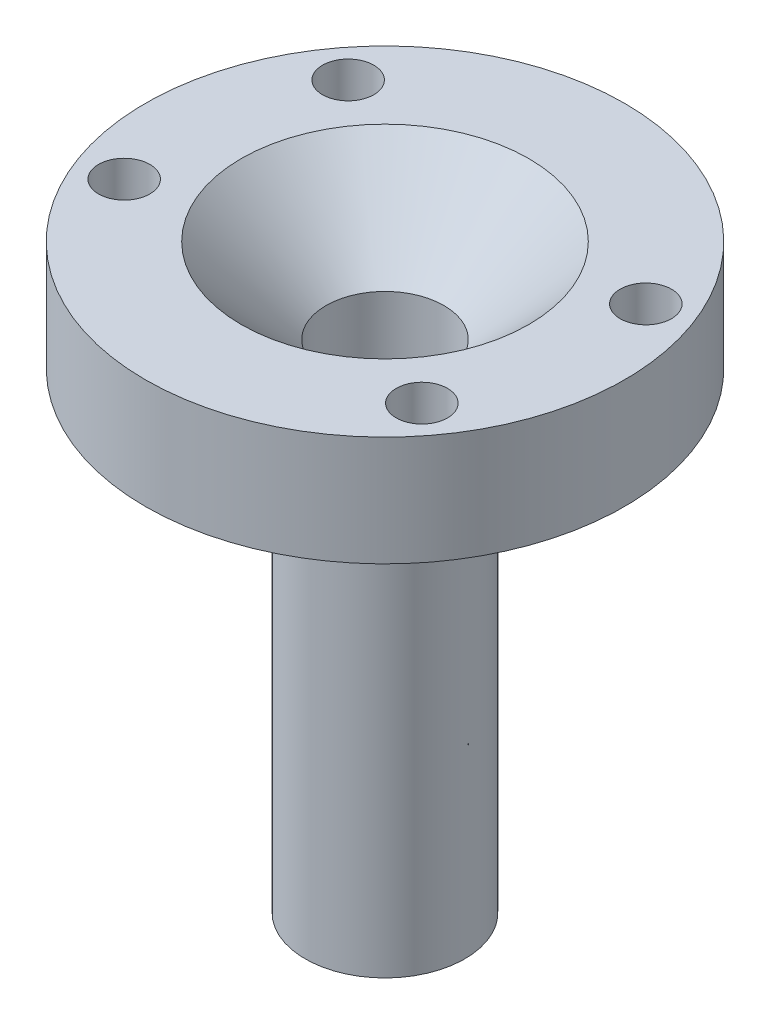
from build123d import *
from build123d.topology import SkipClean

# Parameters (mm, degrees)
SKETCH5_R                   = 7.5
CUT_EXTRUDE1_DEPTH          = 90
SKETCH6_R                   = 3.5
CUT_EXTRUDE2_DEPTH          = 20
CIRPATTERN1_COUNT           = 6
SKETCH11_R                  = 3.18
CUT_EXTRUDE4_DEPTH          = 101.105860558
SKETCH23_R                  = 30.48
CUT_EXTRUDE6_DEPTH          = 80.122584091
F_1_4_CLEARANCE_HOLE1_D     = 6.5278
F_1_4_CLEARANCE_HOLE1_DEPTH = 15.4203
F_1_4_CLEARANCE_HOLE1_TIP   = 1.961148974
CHAMFER1_SIZE               = 3.175
SKETCH26_OUTSIDE_W          = 84.718
SKETCH26_OUTSIDE_H          = 84.718
SKETCH26_OUTSIDE_R          = 15
FOR_TURNING_EASE_DEPTH      = 74.878689756
DELETEFACE2_START           = -60.0000001
DELETEFACE2_OUTLINE_R       = 15
DELETEFACE2_OUTLINE_R_2     = 10.16
DELETEFACE2_DEPTH           = 60.0000001
CHAMFER3_SIZE               = 1.6
SKETCH30_R                  = 21.082
SKETCH30_R_2                = 19.05
GASKET_GROOVE_DEPTH         = 1.27
MOVE_START                  = 6.35
MOVE_FACE3_OUTLINE_R        = 30.48
MOVE_FACE3_OUTLINE_R_2      = 3.2639
MOVE_FACE3_DEPTH            = 7.62


with BuildPart() as part:
    # Sketch1 → Revolve1 (revolve)
    with BuildSketch(Plane(origin=(0, 0, 0), x_dir=(0, 0, -1), z_dir=(1, 0, 0))):
        Polygon((0, 30.35), (12.7, 30.35), (12.7, 6.35), (30.48, 6.35), (30.48, 0), (15.68, 0), (10.16, -20.600920458), (10.16, -60), (0, -60), align=None)
    revolve(axis=Axis((0, 0, 0), (0, 1, 0)))

    # Sketch5 → Cut-Extrude1 (cut)
    with BuildSketch(Plane.XZ.offset(60)):
        with Locations(Location((0, 0, 0), (0, 0, 270))):
            Circle(SKETCH5_R)
    extrude(amount=-CUT_EXTRUDE1_DEPTH, mode=Mode.SUBTRACT)

    # Sketch6 → Cut-Extrude2 (cut, symmetric)
    with BuildSketch(Plane.XY):
        with Locations((0, 16.659966967)):
            Circle(SKETCH6_R)
    cut_extrude2 = extrude(amount=CUT_EXTRUDE2_DEPTH, both=True, mode=Mode.SUBTRACT)

    # CirPattern1: Cut-Extrude2 ×6 about axis
    cirpattern1_axis = Axis((0, 30.35, 0), (0, -1, 0))
    for i in range(1, CIRPATTERN1_COUNT):
        add(cut_extrude2.rotate(cirpattern1_axis, i * 360 / CIRPATTERN1_COUNT), mode=Mode.SUBTRACT)

    # Sketch11 → Cut-Extrude4 (cut, through all)
    with BuildSketch(Plane(origin=(0, 30.35, 0), x_dir=(1, 0, 0), z_dir=(0, 1, 0))):
        with Locations(Location((0, 0, 0), (0, 0, 270))):
            Circle(SKETCH11_R)
    extrude(amount=-CUT_EXTRUDE4_DEPTH, mode=Mode.SUBTRACT)

    # Sketch23 → Cut-Extrude6 (cut, through all)
    with BuildSketch(Plane(origin=(0, 6.35, 0), x_dir=(1, 0, 0), z_dir=(0, 1, 0))):
        with Locations(Location((0, 0, 0), (0, 0, 90))):
            Circle(SKETCH23_R)
    extrude(amount=CUT_EXTRUDE6_DEPTH, mode=Mode.SUBTRACT)

    # 1/4 Clearance Hole1
    with Locations(Plane(origin=(0, 6.35, 0), x_dir=(1, 0, 0), z_dir=(0, 1, 0))):
        with Locations((-20.151174843, 15.462540297), (23.466540126, 9.720159182), (20.151174843, -15.462540297), (-23.466540126, -9.720159182)):
            Hole(F_1_4_CLEARANCE_HOLE1_D / 2, depth=F_1_4_CLEARANCE_HOLE1_DEPTH)
            with Locations((0, 0, -(F_1_4_CLEARANCE_HOLE1_DEPTH + F_1_4_CLEARANCE_HOLE1_TIP / 2))):  # 118° drill point
                Cone(0, F_1_4_CLEARANCE_HOLE1_D / 2, F_1_4_CLEARANCE_HOLE1_TIP, mode=Mode.SUBTRACT)

    # Chamfer1
    chamfer1_edges = [part.edges().sort_by_distance(p)[0] for p in [
        (0, 6.35, 7.5),
    ]]
    chamfer(chamfer1_edges, length=CHAMFER1_SIZE)

    # Sketch26 outside → for-turning-ease (cut, through all)
    with BuildSketch(Plane.XZ):
        Rectangle(SKETCH26_OUTSIDE_W, SKETCH26_OUTSIDE_H)
        with Locations(Location((0, 0, 0), (0, 0, 90))):
            Circle(SKETCH26_OUTSIDE_R, mode=Mode.SUBTRACT)
    extrude(amount=FOR_TURNING_EASE_DEPTH, mode=Mode.SUBTRACT)

    # DeleteFace2: read off the stored shape, not the designer's step
    # DeleteFace2 outline → DeleteFace2 (cut)
    with BuildSketch(Plane(origin=(0, 0, 0), x_dir=(1, 0, 0), z_dir=(0, 1, 0)).offset(DELETEFACE2_START)):
        Circle(DELETEFACE2_OUTLINE_R)
        Circle(DELETEFACE2_OUTLINE_R_2, mode=Mode.SUBTRACT)
    extrude(amount=DELETEFACE2_DEPTH, mode=Mode.SUBTRACT)

    # Chamfer3
    # the kernel refuses this chamfer: 1.6 mm, written as the material it adds along each edge
    with BuildSketch(Plane(origin=(0, 0, 0), x_dir=(1, 0, 0), z_dir=(0, 0, 1))) as chamfer3_piece_1:
        Polygon((10.16 + CHAMFER3_SIZE, 0), (10.16, -CHAMFER3_SIZE), (10.16, 0), align=None)
    revolve(axis=Axis((0, 0, 0), (0, 1, 0)))

    # Sketch30 → gasket_groove (cut)
    with BuildSketch(Plane.XZ):
        with Locations(Location((0, 0, 0), (0, 0, 270))):
            Circle(SKETCH30_R)
        with Locations(Location((0, 0, 0), (0, 0, 270))):
            Circle(SKETCH30_R_2, mode=Mode.SUBTRACT)
    extrude(amount=-GASKET_GROOVE_DEPTH, mode=Mode.SUBTRACT)

    # Move Face3: read off the stored shape, not the designer's step
    # Move Face3 outline → Move Face3 (add)
    with SkipClean():  # the faces are left unmerged after this step: merging them gives an invalid solid
        with BuildSketch(Plane(origin=(0, 0, 0), x_dir=(1, 0, 0), z_dir=(0, 1, 0)).offset(MOVE_START)):
            Circle(MOVE_FACE3_OUTLINE_R)
            with Locations((-23.466540126, -9.720159182)):
                Circle(MOVE_FACE3_OUTLINE_R_2, mode=Mode.SUBTRACT)
            with Locations((20.151174843, -15.462540297)):
                Circle(MOVE_FACE3_OUTLINE_R_2, mode=Mode.SUBTRACT)
            with Locations((-20.151174843, 15.462540297)):
                Circle(MOVE_FACE3_OUTLINE_R_2, mode=Mode.SUBTRACT)
            with Locations((23.466540126, 9.720159182)):
                Circle(MOVE_FACE3_OUTLINE_R_2, mode=Mode.SUBTRACT)
        extrude(amount=MOVE_FACE3_DEPTH)
    add(part.part.scale(1), mode=Mode.REPLACE)  # the faces are merged on a copy

    # Move Face3 2 outline → Move Face3 2 (revolve, cut)
    with SkipClean():  # the faces are left unmerged after this step: merging them gives an invalid solid
        with BuildSketch(Plane.XY):
            Polygon((18.295, 13.97), (0, 13.97), (0, 6.35), (10.675, 6.35), align=None)
        revolve(axis=Axis((0, 0, 0), (0, 1, 0)), mode=Mode.SUBTRACT)


solid = part.part
